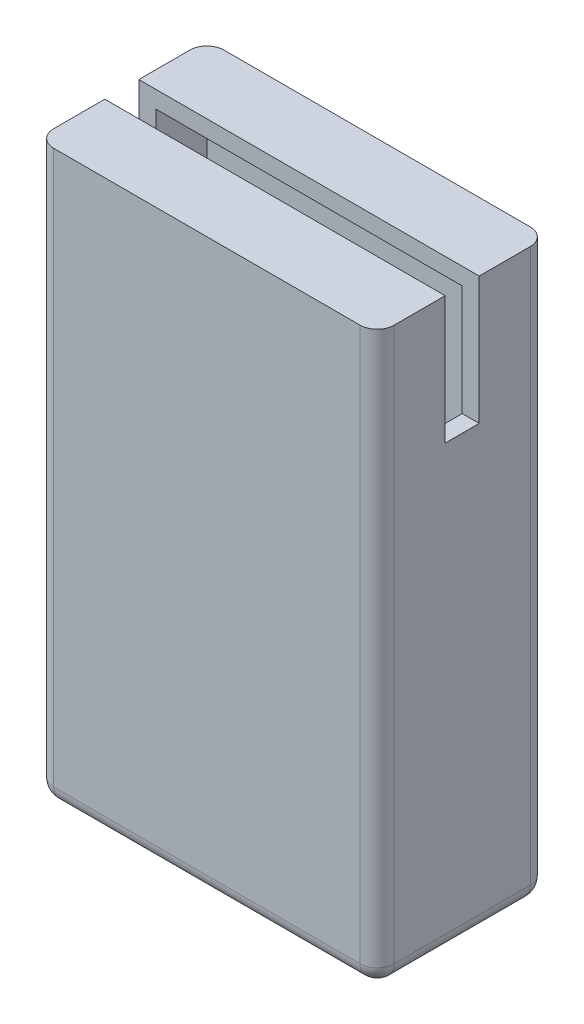
from build123d import *

# Parameters (mm, degrees)
CROQUIS1_W              = 40
CROQUIS1_H              = 67
SALIENTE_EXTRUIR1_DEPTH = 20
REDONDEO1_R             = 2
VACIADO1_START          = -18
VACIADO1_OUTLINE_W      = 65
VACIADO1_OUTLINE_H      = 16
VACIADO1_DEPTH          = 36
CROQUIS2_W              = 40
CROQUIS2_H              = 4
CORTAR_EXTRUIR1_DEPTH   = 15


# Read off the part's stored shape, not the designer's step: Vaciado1
with BuildPart() as part:
    # Croquis1 → Saliente-Extruir1 (new body)
    with BuildSketch(Plane.XY):
        Rectangle(CROQUIS1_W, CROQUIS1_H)
    extrude(amount=SALIENTE_EXTRUIR1_DEPTH)

    # Redondeo1
    redondeo1_edges = [part.edges().sort_by_distance(p)[0] for p in [
        (-20, 0, 20),
        (0, -33.5, 20),
        (20, 0, 20),
        (0, -33.5, 0),
        (-20, 0, 0),
        (20, 0, 0),
        (20, -33.5, 10),
        (-20, -33.5, 10),
    ]]
    fillet(redondeo1_edges, radius=REDONDEO1_R)

    # Vaciado1 outline → Vaciado1 (cut)
    with BuildSketch(Plane.YZ.offset(VACIADO1_START)):
        with Locations((-1, 10)):
            Rectangle(VACIADO1_OUTLINE_W, VACIADO1_OUTLINE_H)
    extrude(amount=VACIADO1_DEPTH, mode=Mode.SUBTRACT)

    # Croquis2 → Cortar-Extruir1 (cut)
    with BuildSketch(Plane(origin=(0, 33.5, 0), x_dir=(1, 0, 0), z_dir=(0, 1, 0))):
        with Locations((0, -10)):
            Rectangle(CROQUIS2_W, CROQUIS2_H)
    extrude(amount=-CORTAR_EXTRUIR1_DEPTH, mode=Mode.SUBTRACT)


solid = part.part
